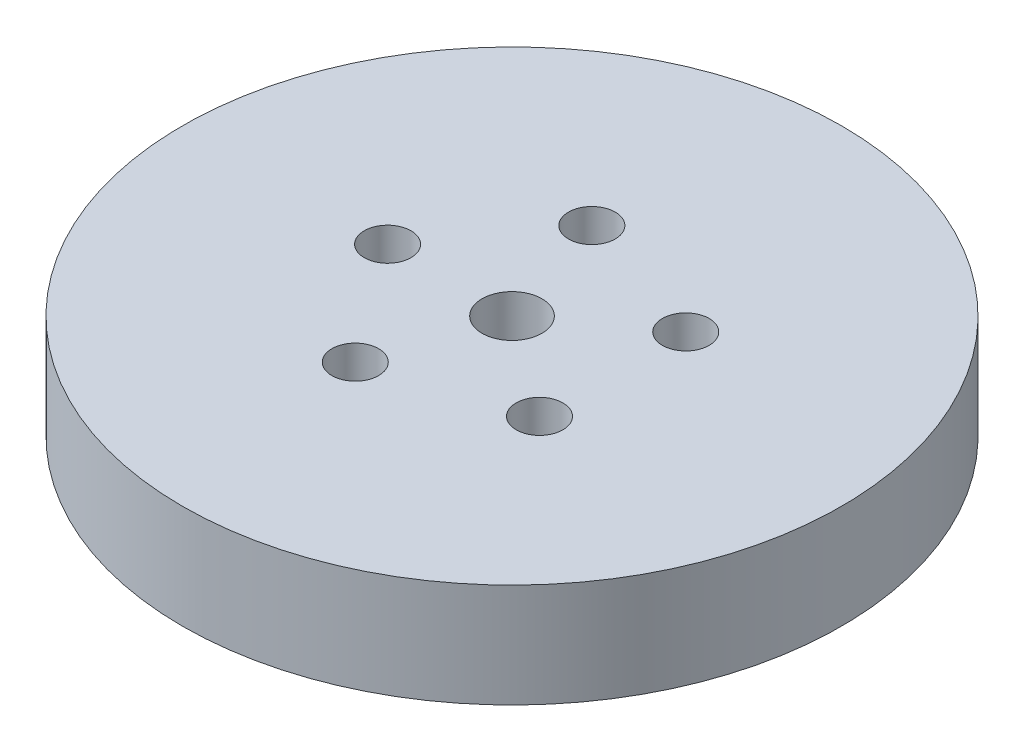
from build123d import *

# Parameters (mm, degrees)
SKETCH1_R           = 82.5
BOSS_EXTRUDE1_DEPTH = 26
SKETCH2_R           = 7.5
CUT_EXTRUDE1_DEPTH  = 120.534513844
SKETCH3_R           = 5.84834959
CUT_EXTRUDE2_DEPTH  = 21.199145031
CIRPATTERN1_COUNT   = 5


with BuildPart() as part:
    # Sketch1 → Boss-Extrude1 (new body)
    with BuildSketch(Plane(origin=(0, 0, 0), x_dir=(1, 0, 0), z_dir=(0, 1, 0))):
        Circle(SKETCH1_R)
    extrude(amount=BOSS_EXTRUDE1_DEPTH)

    # Sketch2 → Cut-Extrude1 (cut, through all)
    with BuildSketch(Plane(origin=(0, 0, 0), x_dir=(1, 0, 0), z_dir=(0, 1, 0))):
        Circle(SKETCH2_R)
    extrude(amount=CUT_EXTRUDE1_DEPTH, mode=Mode.SUBTRACT)

    # Sketch3 → Cut-Extrude2 (cut)
    with BuildSketch(Plane(origin=(0, 26, 0), x_dir=(1, 0, 0), z_dir=(0, 1, 0))):
        with Locations((-31.138577551, 0)):
            Circle(SKETCH3_R)
    cut_extrude2 = extrude(amount=-CUT_EXTRUDE2_DEPTH, mode=Mode.SUBTRACT)

    # CirPattern1: Cut-Extrude2 ×5 about axis
    cirpattern1_axis = Axis((0, 0, 0), (0, 1, 0))
    for i in range(1, CIRPATTERN1_COUNT):
        add(cut_extrude2.rotate(cirpattern1_axis, i * 360 / CIRPATTERN1_COUNT), mode=Mode.SUBTRACT)


solid = part.part
